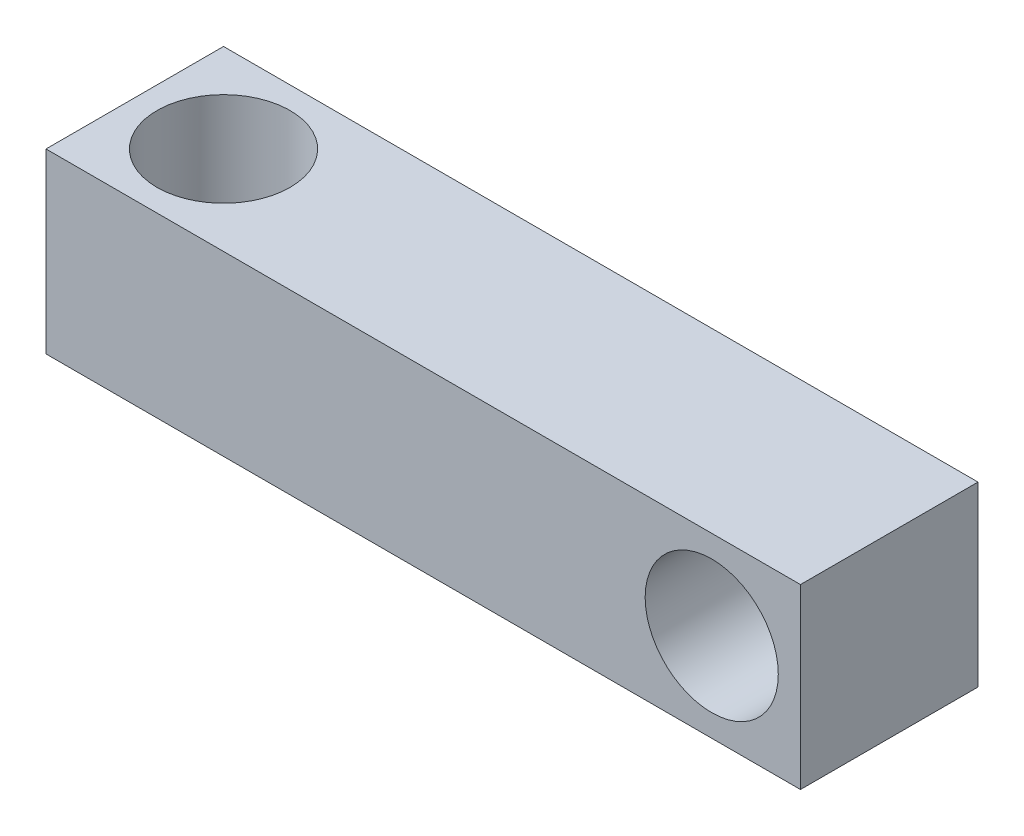
from build123d import *

# Parameters (mm, degrees)
SALIENTE_EXTRUIR1_DEPTH    = 10
CORTAR_EXTRUIR1_DEPTH      = 49.420305809
CORTAR_EXTRUIR1_DEPTH_BACK = 49.420305809
CROQUIS2_R                 = 7.5
CORTAR_EXTRUIR2_DEPTH      = 49.023431781
CORTAR_EXTRUIR2_DEPTH_BACK = 49.023431781
CROQUIS3_R                 = 7.5


with BuildPart() as part:
    # Croquis1 → Saliente-Extruir1 (new, symmetric)
    with BuildSketch(Plane.XY):
        Polygon((0, 11.759082218), (42.5, 11.759082218), (42.5, -8.240917782), (-42.5, -8.240917782), (-42.5, 11.759082218), align=None)
    extrude(amount=SALIENTE_EXTRUIR1_DEPTH, both=True)

    # Croquis2 → Cortar-Extruir1 (cut, two sides: drawn at the far end of the back side and taken through both)
    with BuildSketch(Plane.XY.offset(10).offset(-CORTAR_EXTRUIR1_DEPTH_BACK)):
        with Locations((32.5, 1.759082218)):
            Circle(CROQUIS2_R)
    extrude(amount=CORTAR_EXTRUIR1_DEPTH + CORTAR_EXTRUIR1_DEPTH_BACK, mode=Mode.SUBTRACT)

    # Croquis3 → Cortar-Extruir2 (cut, two sides: drawn at the far end of the back side and taken through both)
    with BuildSketch(Plane(origin=(0, 11.759082218, 0), x_dir=(1, 0, 0), z_dir=(0, 1, 0)).offset(-CORTAR_EXTRUIR2_DEPTH_BACK)):
        with Locations((-32.5, 0)):
            Circle(CROQUIS3_R)
    extrude(amount=CORTAR_EXTRUIR2_DEPTH + CORTAR_EXTRUIR2_DEPTH_BACK, mode=Mode.SUBTRACT)


solid = part.part
